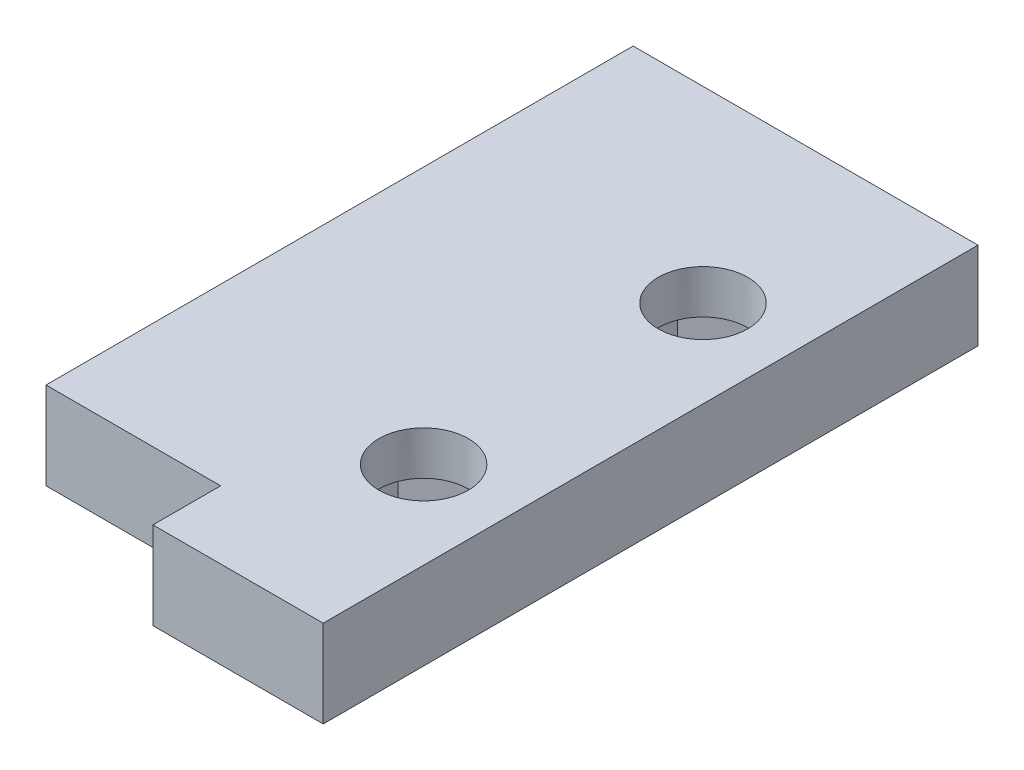
from build123d import *

# Parameters (mm, degrees)
SKETCH_1_W          = 15.8
SKETCH_1_H          = 30
EXTRUDE_1_DEPTH     = 4
SKETCH_2_R          = 2.05
CUT_EXTRUDE_1_DEPTH = 35.141470384
CUT_EXTRUDE_2_DEPTH = 2
CUT_EXTRUDE_3_REACH = 36.141
SKETCH_7_W          = 8
SKETCH_7_H          = 3.1


with BuildPart() as part:
    # 草图1 → 凸台-拉伸1 (new body)
    with BuildSketch(Plane(origin=(0, 0, 0), x_dir=(1, 0, 0), z_dir=(0, 1, 0))):
        with Locations((7.9, 15)):
            Rectangle(SKETCH_1_W, SKETCH_1_H)
    extrude(amount=EXTRUDE_1_DEPTH)

    # 草图2 → 切除-拉伸1 (cut, through all)
    with BuildSketch(Plane(origin=(0, 4, 0), x_dir=(1, 0, 0), z_dir=(0, 1, 0))):
        with Locations((11.8, 21.4)):
            Circle(SKETCH_2_R)
        with Locations((11.8, 8.6)):
            Circle(SKETCH_2_R)
    extrude(amount=-CUT_EXTRUDE_1_DEPTH, mode=Mode.SUBTRACT)

    # 草图5 → 切除-拉伸2 (cut)
    with BuildSketch(Plane.XZ):
        Polygon((14.55, -7.01228676), (11.8, -5.424573519), (9.05, -7.01228676), (9.05, -10.18771324), (11.8, -11.775426481), (14.55, -10.18771324), align=None)
        Polygon((9.05, -22.98771324), (11.8, -24.575426481), (14.55, -22.98771324), (14.55, -19.81228676), (11.8, -18.224573519), (9.05, -19.81228676), align=None)
    extrude(amount=-CUT_EXTRUDE_2_DEPTH, mode=Mode.SUBTRACT)

    # 草图7 → 切除-拉伸3 (cut, up to next)
    with BuildSketch(Plane(origin=(0, 4, 0), x_dir=(1, 0, 0), z_dir=(0, 1, 0)), mode=Mode.PRIVATE) as cut_extrude_3_sk1:
        with Locations((4, 1.55)):
            Rectangle(SKETCH_7_W, SKETCH_7_H)
    cut_extrude_3_tool1 = extrude(cut_extrude_3_sk1.sketch, amount=-CUT_EXTRUDE_3_REACH, mode=Mode.PRIVATE) & part.part
    add(cut_extrude_3_tool1.solids().sort_by_distance((4, 4, -1.55))[0], mode=Mode.SUBTRACT)


solid = part.part
